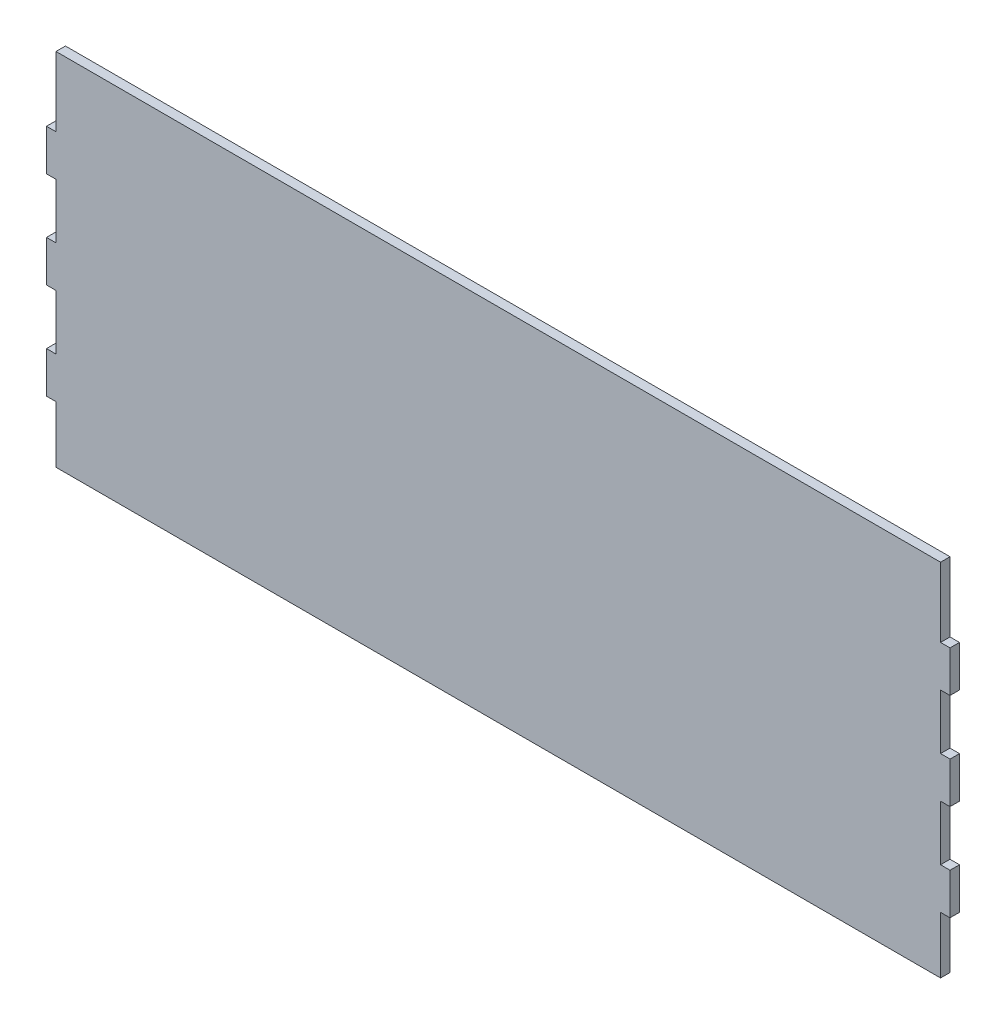
from build123d import *

# Parameters (mm, degrees)
CROQUIS1_W              = 286.03
CROQUIS1_H              = 110
SALIENTE_EXTRUIR1_DEPTH = 3
CROQUIS2_W              = 3
CROQUIS2_H              = 18
CROQUIS2_H_2            = 17.427708433
CORTAR_EXTRUIR1_DEPTH   = 3
CROQUIS4_W              = 280.03
CROQUIS4_H              = 4
SALIENTE_EXTRUIR3_DEPTH = 3


with BuildPart() as part:
    # Croquis1 → Saliente-Extruir1 (new body)
    with BuildSketch(Plane.XY):
        Rectangle(CROQUIS1_W, CROQUIS1_H)
    extrude(amount=SALIENTE_EXTRUIR1_DEPTH)

    # Croquis2 → Cortar-Extruir1 (cut)
    with BuildSketch(Plane.XY.offset(3)):
        with Locations((-141.515, 46)):
            Rectangle(CROQUIS2_W, CROQUIS2_H)
        with Locations((-141.515, 15.237951406)):
            Rectangle(CROQUIS2_W, CROQUIS2_H_2)
        with Locations((141.515, 46)):
            Rectangle(CROQUIS2_W, CROQUIS2_H)
        with Locations((-141.515, -15.237951406)):
            Rectangle(CROQUIS2_W, CROQUIS2_H_2)
        with Locations((141.515, 15.237951406)):
            Rectangle(CROQUIS2_W, CROQUIS2_H_2)
        with Locations((-141.515, -46)):
            Rectangle(CROQUIS2_W, CROQUIS2_H)
        with Locations((141.515, -15.237951406)):
            Rectangle(CROQUIS2_W, CROQUIS2_H_2)
        with Locations((141.515, -46)):
            Rectangle(CROQUIS2_W, CROQUIS2_H)
    extrude(amount=-CORTAR_EXTRUIR1_DEPTH, mode=Mode.SUBTRACT)

    # Croquis4 → Saliente-Extruir3 (add)
    with BuildSketch(Plane(origin=(0, 0, 0), x_dir=(-1, 0, 0), z_dir=(0, 0, -1))):
        with Locations((0, 57)):
            Rectangle(CROQUIS4_W, CROQUIS4_H)
    extrude(amount=-SALIENTE_EXTRUIR3_DEPTH)


solid = part.part
